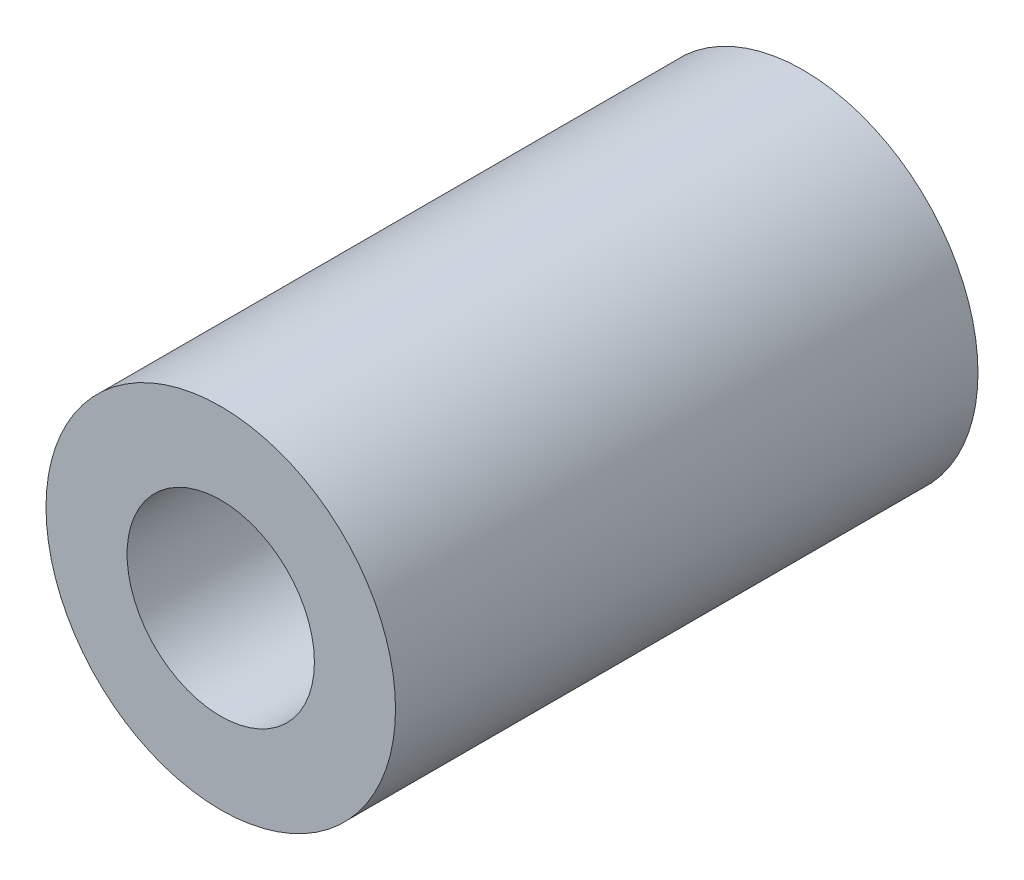
from build123d import *

# Parameters (mm, degrees)
SKETCH1_R           = 4.7625
SKETCH1_R_2         = 2.5527
BOSS_EXTRUDE1_DEPTH = 7.9375


with BuildPart() as part:
    # Sketch1 → Boss-Extrude1 (new, symmetric)
    with BuildSketch(Plane.XY):
        Circle(SKETCH1_R)
        Circle(SKETCH1_R_2, mode=Mode.SUBTRACT)
    extrude(amount=BOSS_EXTRUDE1_DEPTH, both=True)


solid = part.part
